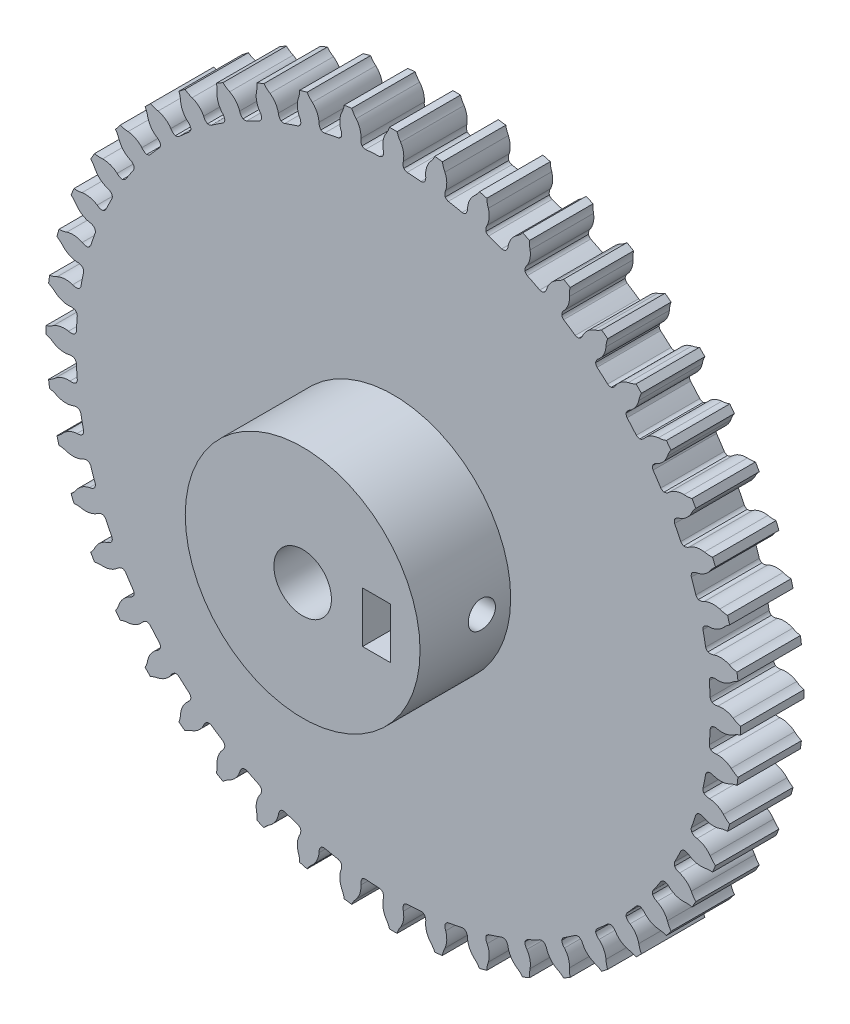
from build123d import *

# Parameters (mm, degrees)
SKETCH1_R           = 3.175
BOSS_EXTRUDE1_DEPTH = 7
SKETCH1_3_R         = 12.956207623
SKETCH1_3_R_2       = 3.175
BOSS_EXTRUDE2_DEPTH = 17
SKETCH2_W           = 3.1
SKETCH2_H           = 5.6
CUT_EXTRUDE1_DEPTH  = 8.5
CUT_EXTRUDE2_DEPTH  = 3.1
SKETCH4_R           = 1.5
CUT_EXTRUDE3_DEPTH  = 11.1


with BuildPart() as part:
    # Sketch1 → Boss-Extrude1 (new body)
    with BuildSketch(Plane.XY):
        with BuildLine():
            ThreePointArc((27.683044726, 56.438791894), (27.524119176, 56.020070925), (27.295284395, 55.635078427))
            ThreePointArc((27.295284395, 55.635078427), (26.982723732, 54.827190352), (26.985570972, 53.960951815))
            ThreePointArc((26.985570972, 53.960951815), (27.029657831, 53.626193463), (26.943690328, 53.299671803))
            ThreePointArc((26.943690328, 53.299671803), (26.780268889, 53.169967492), (26.584598572, 53.097559604))
            ThreePointArc((26.584598572, 53.097559604), (25.814147706, 53.055584927), (25.04480936, 52.996636487))
            ThreePointArc((25.04480936, 52.996636487), (24.841361904, 53.042884814), (24.662408748, 53.150148709))
            ThreePointArc((24.662408748, 53.150148709), (24.53455708, 53.46265592), (24.534572037, 53.800304858))
            ThreePointArc((24.534572037, 53.800304858), (24.424328101, 54.659504243), (24.008990883, 55.41968337))
            ThreePointArc((24.008990883, 55.41968337), (23.73186221, 55.771513271), (23.519642236, 56.165908078))
            Line((23.519642236, 56.165908078), (22.686407183, 56.056210602))
            ThreePointArc((22.686407183, 56.056210602), (22.583495317, 55.620327902), (22.406869853, 55.208760135))
            ThreePointArc((22.406869853, 55.208760135), (22.202433744, 54.366986302), (22.318323443, 53.508530195))
            ThreePointArc((22.318323443, 53.508530195), (22.405727867, 53.182390237), (22.363115456, 52.847441005))
            ThreePointArc((22.363115456, 52.847441005), (22.21802192, 52.697515553), (22.033476715, 52.600187024))
            ThreePointArc((22.033476715, 52.600187024), (21.275095959, 52.458007428), (20.520033724, 52.299144495))
            ThreePointArc((20.520033724, 52.299144495), (20.312290171, 52.31844194), (20.120867237, 52.401430103))
            ThreePointArc((20.120867237, 52.401430103), (19.953318981, 52.694575779), (19.90926178, 53.029338036))
            ThreePointArc((19.90926178, 53.029338036), (19.687812972, 53.866797131), (19.176805735, 54.566260435))
            ThreePointArc((19.176805735, 54.566260435), (18.856124919, 54.878907832), (18.594241664, 55.242228271))
            Line((18.594241664, 55.242228271), (17.782453446, 55.024710273))
            ThreePointArc((17.782453446, 55.024710273), (17.737316114, 54.579123916), (17.615922079, 54.14802292))
            ThreePointArc((17.615922079, 54.14802292), (17.523108482, 53.286766311), (17.750057736, 52.450781056))
            ThreePointArc((17.750057736, 52.450781056), (17.879284209, 52.138839837), (17.880756001, 51.801194107))
            ThreePointArc((17.880756001, 51.801194107), (17.756472959, 51.633612782), (17.586210487, 51.513028928))
            ThreePointArc((17.586210487, 51.513028928), (16.852875944, 51.273077146), (16.125009145, 51.01701791))
            ThreePointArc((16.125009145, 51.01701791), (15.916524045, 51.009034287), (15.715906631, 51.066326768))
            ThreePointArc((15.715906631, 51.066326768), (15.511528585, 51.335095107), (15.424153057, 51.661242807))
            ThreePointArc((15.424153057, 51.661242807), (15.095288427, 52.462632454), (14.497354646, 53.089411923))
            ThreePointArc((14.497354646, 53.089411923), (14.138608625, 53.357527332), (13.831542984, 53.683556891))
            Line((13.831542984, 53.683556891), (13.055091522, 53.361940165))
            ThreePointArc((13.055091522, 53.361940165), (13.068501037, 52.914274256), (13.004415517, 52.471016288))
            ThreePointArc((13.004415517, 52.471016288), (13.024812499, 51.605013243), (13.358938142, 50.805802781))
            ThreePointArc((13.358938142, 50.805802781), (13.527775565, 50.513397701), (13.573306377, 50.178832684))
            ThreePointArc((13.573306377, 50.178832684), (13.471960345, 49.996462848), (13.318893844, 49.854686894))
            ThreePointArc((13.318893844, 49.854686894), (12.623153072, 49.521068568), (11.934935711, 49.172194271))
            ThreePointArc((11.934935711, 49.172194271), (11.729276302, 49.137066183), (11.522897029, 49.167682692))
            ThreePointArc((11.522897029, 49.167682692), (11.285186157, 49.407474993), (11.155987322, 49.71942766))
            ThreePointArc((11.155987322, 49.71942766), (10.725333835, 50.471035858), (10.050704323, 51.014407123))
            ThreePointArc((10.050704323, 51.014407123), (9.66003134, 51.233403016), (9.313037292, 51.516563237))
            Line((9.313037292, 51.516563237), (8.585207887, 51.096350734))
            ThreePointArc((8.585207887, 51.096350734), (8.656934808, 50.654264962), (8.651254323, 50.206434288))
            ThreePointArc((8.651254323, 50.206434288), (8.784512885, 49.35050236), (9.220097936, 48.601741402))
            ThreePointArc((9.220097936, 48.601741402), (9.425657452, 48.333875594), (9.51446824, 48.008115791))
            ThreePointArc((9.51446824, 48.008115791), (9.437793278, 47.814077843), (9.304541757, 47.653535614))
            ThreePointArc((9.304541757, 47.653535614), (8.658299074, 47.231959044), (8.021506742, 46.796239025))
            ThreePointArc((8.021506742, 46.796239025), (7.822191913, 46.734567523), (7.613581986, 46.737984203))
            ThreePointArc((7.613581986, 46.737984203), (7.346605589, 46.944697552), (7.177794073, 47.237117588))
            ThreePointArc((7.177794073, 47.237117588), (6.652720331, 47.926084115), (5.912938186, 48.376749942))
            ThreePointArc((5.912938186, 48.376749942), (5.497022764, 48.542879237), (5.116037472, 48.778325172))
            Line((5.116037472, 48.778325172), (4.449283487, 48.266706844))
            ThreePointArc((4.449283487, 48.266706844), (4.578100546, 47.83776542), (4.630922291, 47.393024547))
            ThreePointArc((4.630922291, 47.393024547), (4.874762344, 46.561808968), (5.404353821, 45.876309021))
            ThreePointArc((5.404353821, 45.876309021), (5.643118251, 45.637565744), (5.773689437, 45.326184995))
            ThreePointArc((5.773689437, 45.326184995), (5.722997474, 45.123798977), (5.611840904, 44.947237396))
            ThreePointArc((5.611840904, 44.947237396), (5.026153701, 44.444915876), (4.451682091, 43.929805423))
            ThreePointArc((4.451682091, 43.929805423), (4.262122174, 43.842645723), (4.054850968, 43.818804114))
            ThreePointArc((4.054850968, 43.818804114), (3.763177084, 43.988901589), (3.557641301, 44.256785607))
            ThreePointArc((3.557641301, 44.256785607), (2.94713146, 44.871322053), (2.154854559, 45.221571425))
            ThreePointArc((2.154854559, 45.221571425), (1.720813127, 45.331991605), (1.312355356, 45.515694708))
            Line((1.312355356, 45.515694708), (0.718085135, 44.921424487))
            ThreePointArc((0.718085135, 44.921424487), (0.901788238, 44.512966716), (1.012208418, 44.078925284))
            ThreePointArc((1.012208418, 44.078925284), (1.36245779, 43.286648384), (1.976994236, 42.676138543))
            ThreePointArc((1.976994236, 42.676138543), (2.244878254, 42.470602759), (2.414975729, 42.178928875))
            ThreePointArc((2.414975729, 42.178928875), (2.39113412, 41.971657669), (2.30397442, 41.782097753))
            ThreePointArc((2.30397442, 41.782097753), (1.788863968, 41.207626142), (1.286542448, 40.621938939))
            ThreePointArc((1.286542448, 40.621938939), (1.109980866, 40.510782369), (0.907594849, 40.460090406))
            ThreePointArc((0.907594849, 40.460090406), (0.596214099, 40.590661592), (0.357470822, 40.829426023))
            ThreePointArc((0.357470822, 40.829426023), (-0.328029125, 41.359017499), (-1.159244703, 41.602857552))
            ThreePointArc((-1.159244703, 41.602857552), (-1.603985576, 41.655679297), (-2.032927001, 41.784496357))
            Line((-2.032927001, 41.784496357), (-2.544545329, 41.117742371))
            ThreePointArc((-2.544545329, 41.117742371), (-2.309099394, 40.736757079), (-2.142970098, 40.320841658))
            ThreePointArc((-2.142970098, 40.320841658), (-1.692304272, 39.581059513), (-1.003337745, 39.05598577))
            ThreePointArc((-1.003337745, 39.05598577), (-0.710917708, 38.887174255), (-0.504204359, 38.620197857))
            ThreePointArc((-0.504204359, 38.620197857), (-0.50078768, 38.41158793), (-0.562459182, 38.212273101))
            ThreePointArc((-0.562459182, 38.212273101), (-0.998179201, 37.57548077), (-1.41975577, 36.929238086))
            ThreePointArc((-1.41975577, 36.929238086), (-1.580297999, 36.795986565), (-1.774335948, 36.719311603))
            ThreePointArc((-1.774335948, 36.719311603), (-2.100095751, 36.808122391), (-2.367961558, 37.013681907))
            ThreePointArc((-2.367961558, 37.013681907), (-3.116722517, 37.449266958), (-3.972654445, 37.582525521))
            ThreePointArc((-3.972654445, 37.582525521), (-4.420485119, 37.576845036), (-4.862570891, 37.648571957))
            Line((-4.862570891, 37.648571957), (-5.282783394, 36.920742551))
            ThreePointArc((-5.282783394, 36.920742551), (-4.999623172, 36.573748503), (-4.78062728, 36.18307552))
            ThreePointArc((-4.78062728, 36.18307552), (-4.237256015, 35.508446008), (-3.485647816, 35.077792522))
            ThreePointArc((-3.485647816, 35.077792522), (-3.173695149, 34.948593686), (-2.933902849, 34.710882815))
            ThreePointArc((-2.933902849, 34.710882815), (-2.90328634, 34.504503541), (-2.938414428, 34.298844132))
            ThreePointArc((-2.938414428, 34.298844132), (-3.287288724, 33.610626772), (-3.620907051, 32.914886))
            ThreePointArc((-3.620907051, 32.914886), (-3.762683005, 32.761819498), (-3.945052841, 32.660473466))
            ThreePointArc((-3.945052841, 32.660473466), (-4.279617858, 32.706004279), (-4.572022937, 32.874841701))
            ThreePointArc((-4.572022937, 32.874841701), (-5.3712334, 33.208967344), (-6.237236444, 33.229364327))
            ThreePointArc((-6.237236444, 33.229364327), (-6.680494413, 33.165278806), (-7.128160322, 33.178688321))
            Line((-7.128160322, 33.178688321), (-7.449777048, 32.402236859))
            ThreePointArc((-7.449777048, 32.402236859), (-7.123747489, 32.095171218), (-6.85563208, 31.736425197))
            ThreePointArc((-6.85563208, 31.736425197), (-6.22885261, 31.138491416), (-5.427462964, 30.809626786))
            ThreePointArc((-5.427462964, 30.809626786), (-5.101315263, 30.722251258), (-4.832546925, 30.517873212))
            ThreePointArc((-4.832546925, 30.517873212), (-4.775254443, 30.317255798), (-4.783238066, 30.108770698))
            ThreePointArc((-4.783238066, 30.108770698), (-5.039297303, 29.380903899), (-5.279249085, 28.647569357))
            ThreePointArc((-5.279249085, 28.647569357), (-5.399832938, 28.477306884), (-5.567414263, 28.353023842))
            ThreePointArc((-5.567414263, 28.353023842), (-5.905059994, 28.354495634), (-6.217001213, 28.483722108))
            ThreePointArc((-6.217001213, 28.483722108), (-7.052986468, 28.710671361), (-7.914243076, 28.617857764))
            ThreePointArc((-7.914243076, 28.617857764), (-8.345344073, 28.49646373), (-8.79093043, 28.451326398))
            Line((-8.79093043, 28.451326398), (-9.008448428, 27.639538179))
            ThreePointArc((-9.008448428, 27.639538179), (-8.645127988, 27.377654925), (-8.332480591, 27.056974108))
            ThreePointArc((-8.332480591, 27.056974108), (-7.633017288, 26.545966872), (-6.795558193, 26.324518063))
            ThreePointArc((-6.795558193, 26.324518063), (-6.460795936, 26.280460862), (-6.16765026, 26.112912607))
            ThreePointArc((-6.16765026, 26.112912607), (-6.084662096, 25.921489672), (-6.065364652, 25.713746119))
            ThreePointArc((-6.065364652, 25.713746119), (-6.224227585, 24.958683884), (-6.36640718, 24.200303128))
            ThreePointArc((-6.36640718, 24.200303128), (-6.46373571, 24.015757923), (-6.613661161, 23.870664387))
            ThreePointArc((-6.613661161, 23.870664387), (-6.948610393, 23.828051977), (-7.274750352, 23.9154564))
            ThreePointArc((-7.274750352, 23.9154564), (-8.133206458, 24.031346099), (-8.974980292, 23.82690999))
            ThreePointArc((-8.974980292, 23.82690999), (-9.386548058, 23.650284527), (-9.822430759, 23.54737266))
            Line((-9.822430759, 23.54737266), (-9.932128235, 22.714137607))
            ThreePointArc((-9.932128235, 22.714137607), (-9.537733428, 22.501917633), (-9.185903527, 22.22478896))
            ThreePointArc((-9.185903527, 22.22478896), (-8.4257244, 21.809451742), (-7.566525014, 21.699207806))
            ThreePointArc((-7.566525014, 21.699207806), (-7.228876076, 21.699222763), (-6.916368866, 21.571371095))
            ThreePointArc((-6.916368866, 21.571371095), (-6.809104971, 21.392417939), (-6.762856644, 21.188970483))
            ThreePointArc((-6.762856644, 21.188970483), (-6.821805084, 20.419632137), (-6.863779761, 19.649181272))
            ThreePointArc((-6.863779761, 19.649181272), (-6.936187649, 19.453510955), (-7.06589196, 19.290089515))
            ThreePointArc((-7.06589196, 19.290089515), (-7.39241362, 19.204122012), (-7.727171972, 19.248208872))
            ThreePointArc((-7.727171972, 19.248208872), (-8.593410509, 19.251056112), (-9.401298584, 18.938495449))
            ThreePointArc((-9.401298584, 18.938495449), (-9.786291081, 18.709660667), (-10.205012051, 18.550735117))
            Line((-10.205012051, 18.550735117), (-10.205012051, 17.710310111))
            ThreePointArc((-10.205012051, 17.710310111), (-9.786291081, 17.551384561), (-9.401298584, 17.322549779))
            ThreePointArc((-9.401298584, 17.322549779), (-8.593410509, 17.009989116), (-7.727171972, 17.012836356))
            ThreePointArc((-7.727171972, 17.012836356), (-7.39241362, 17.056923216), (-7.06589196, 16.970955712))
            ThreePointArc((-7.06589196, 16.970955712), (-6.936187649, 16.807534273), (-6.863779761, 16.611863956))
            ThreePointArc((-6.863779761, 16.611863956), (-6.821805084, 15.841413091), (-6.762856644, 15.072074745))
            ThreePointArc((-6.762856644, 15.072074745), (-6.809104971, 14.868627288), (-6.916368866, 14.689674133))
            ThreePointArc((-6.916368866, 14.689674133), (-7.228876076, 14.561822464), (-7.566525014, 14.561837422))
            ThreePointArc((-7.566525014, 14.561837422), (-8.4257244, 14.451593485), (-9.185903527, 14.036256268))
            ThreePointArc((-9.185903527, 14.036256268), (-9.537733428, 13.759127595), (-9.932128235, 13.546907621))
            Line((-9.932128235, 13.546907621), (-9.822430759, 12.713672567))
            ThreePointArc((-9.822430759, 12.713672567), (-9.386548058, 12.610760701), (-8.974980292, 12.434135238))
            ThreePointArc((-8.974980292, 12.434135238), (-8.133206458, 12.229699128), (-7.274750352, 12.345588828))
            ThreePointArc((-7.274750352, 12.345588828), (-6.948610393, 12.432993251), (-6.613661161, 12.390380841))
            ThreePointArc((-6.613661161, 12.390380841), (-6.46373571, 12.245287304), (-6.36640718, 12.0607421))
            ThreePointArc((-6.36640718, 12.0607421), (-6.224227585, 11.302361343), (-6.065364652, 10.547299109))
            ThreePointArc((-6.065364652, 10.547299109), (-6.084662096, 10.339555556), (-6.16765026, 10.148132621))
            ThreePointArc((-6.16765026, 10.148132621), (-6.460795936, 9.980584365), (-6.795558193, 9.936527165))
            ThreePointArc((-6.795558193, 9.936527165), (-7.633017288, 9.715078356), (-8.332480591, 9.204071119))
            ThreePointArc((-8.332480591, 9.204071119), (-8.645127988, 8.883390303), (-9.008448428, 8.621507048))
            Line((-9.008448428, 8.621507048), (-8.79093043, 7.80971883))
            ThreePointArc((-8.79093043, 7.80971883), (-8.345344073, 7.764581498), (-7.914243076, 7.643187463))
            ThreePointArc((-7.914243076, 7.643187463), (-7.052986468, 7.550373867), (-6.217001213, 7.77732312))
            ThreePointArc((-6.217001213, 7.77732312), (-5.905059994, 7.906549594), (-5.567414263, 7.908021386))
            ThreePointArc((-5.567414263, 7.908021386), (-5.399832938, 7.783738343), (-5.279249085, 7.613475871))
            ThreePointArc((-5.279249085, 7.613475871), (-5.039297303, 6.880141328), (-4.783238066, 6.15227453))
            ThreePointArc((-4.783238066, 6.15227453), (-4.775254443, 5.943789429), (-4.832546925, 5.743172016))
            ThreePointArc((-4.832546925, 5.743172016), (-5.101315263, 5.53879397), (-5.427462964, 5.451418442))
            ThreePointArc((-5.427462964, 5.451418442), (-6.22885261, 5.122553812), (-6.85563208, 4.524620031))
            ThreePointArc((-6.85563208, 4.524620031), (-7.123747489, 4.165874009), (-7.449777048, 3.858808369))
            Line((-7.449777048, 3.858808369), (-7.128160322, 3.082356907))
            ThreePointArc((-7.128160322, 3.082356907), (-6.680494413, 3.095766422), (-6.237236444, 3.031680901))
            ThreePointArc((-6.237236444, 3.031680901), (-5.3712334, 3.052077883), (-4.572022937, 3.386203527))
            ThreePointArc((-4.572022937, 3.386203527), (-4.279617858, 3.555040949), (-3.945052841, 3.600571762))
            ThreePointArc((-3.945052841, 3.600571762), (-3.762683005, 3.49922573), (-3.620907051, 3.346159228))
            ThreePointArc((-3.620907051, 3.346159228), (-3.287288724, 2.650418456), (-2.938414428, 1.962201096))
            ThreePointArc((-2.938414428, 1.962201096), (-2.90328634, 1.756541687), (-2.933902849, 1.550162413))
            ThreePointArc((-2.933902849, 1.550162413), (-3.173695149, 1.312451542), (-3.485647816, 1.183252706))
            ThreePointArc((-3.485647816, 1.183252706), (-4.237256015, 0.75259922), (-4.78062728, 0.077969708))
            ThreePointArc((-4.78062728, 0.077969708), (-4.999623172, -0.312703275), (-5.282783394, -0.659697324))
            Line((-5.282783394, -0.659697324), (-4.862570891, -1.387526729))
            ThreePointArc((-4.862570891, -1.387526729), (-4.420485119, -1.315799808), (-3.972654445, -1.321480293))
            ThreePointArc((-3.972654445, -1.321480293), (-3.116722517, -1.18822173), (-2.367961558, -0.752636679))
            ThreePointArc((-2.367961558, -0.752636679), (-2.100095751, -0.547077163), (-1.774335947, -0.458266375))
            ThreePointArc((-1.774335947, -0.458266375), (-1.580297999, -0.534941337), (-1.41975577, -0.668192859))
            ThreePointArc((-1.41975577, -0.668192859), (-0.998179201, -1.314435542), (-0.562459182, -1.951227874))
            ThreePointArc((-0.562459182, -1.951227874), (-0.50078768, -2.150542703), (-0.504204359, -2.359152629))
            ThreePointArc((-0.504204359, -2.359152629), (-0.710917708, -2.626129027), (-1.003337745, -2.794940543))
            ThreePointArc((-1.003337745, -2.794940543), (-1.692304272, -3.320014285), (-2.142970098, -4.05979643))
            ThreePointArc((-2.142970098, -4.05979643), (-2.309099394, -4.475711851), (-2.544545329, -4.856697143))
            Line((-2.544545329, -4.856697143), (-2.032927001, -5.523451129))
            ThreePointArc((-2.032927001, -5.523451129), (-1.603985576, -5.394634069), (-1.159244703, -5.341812324))
            ThreePointArc((-1.159244703, -5.341812324), (-0.328029125, -5.097972272), (0.357470822, -4.568380795))
            ThreePointArc((0.357470822, -4.568380795), (0.596214099, -4.329616365), (0.907594849, -4.199045178))
            ThreePointArc((0.907594849, -4.199045178), (1.109980866, -4.249737141), (1.286542448, -4.360893711))
            ThreePointArc((1.286542448, -4.360893711), (1.788863968, -4.946580915), (2.30397442, -5.521052525))
            ThreePointArc((2.30397442, -5.521052525), (2.39113412, -5.710612441), (2.414975729, -5.917883647))
            ThreePointArc((2.414975729, -5.917883647), (2.244878254, -6.209557531), (1.976994236, -6.415093315))
            ThreePointArc((1.976994236, -6.415093315), (1.36245779, -7.025603156), (1.012208418, -7.817880056))
            ThreePointArc((1.012208418, -7.817880056), (0.901788238, -8.251921488), (0.718085135, -8.660379259))
            Line((0.718085135, -8.660379259), (1.312355356, -9.25464948))
            ThreePointArc((1.312355356, -9.25464948), (1.720813127, -9.070946377), (2.154854559, -8.960526197))
            ThreePointArc((2.154854559, -8.960526197), (2.94713146, -8.610276826), (3.557641301, -7.995740379))
            ThreePointArc((3.557641301, -7.995740379), (3.763177084, -7.727856361), (4.054850968, -7.557758886))
            ThreePointArc((4.054850968, -7.557758886), (4.262122174, -7.581600496), (4.451682091, -7.668760195))
            ThreePointArc((4.451682091, -7.668760195), (5.026153701, -8.183870648), (5.611840904, -8.686192168))
            ThreePointArc((5.611840904, -8.686192168), (5.722997474, -8.862753749), (5.773689437, -9.065139767))
            ThreePointArc((5.773689437, -9.065139767), (5.643118251, -9.376520516), (5.404353821, -9.615263793))
            ThreePointArc((5.404353821, -9.615263793), (4.874762344, -10.30076374), (4.630922291, -11.131979319))
            ThreePointArc((4.630922291, -11.131979319), (4.578100546, -11.576720192), (4.449283487, -12.005661617))
            Line((4.449283487, -12.005661617), (5.116037472, -12.517279944))
            ThreePointArc((5.116037472, -12.517279944), (5.497022764, -12.281834009), (5.912938186, -12.115704714))
            ThreePointArc((5.912938186, -12.115704714), (6.652720331, -11.665038887), (7.177794073, -10.97607236))
            ThreePointArc((7.177794073, -10.97607236), (7.346605589, -10.683652324), (7.613581986, -10.476938975))
            ThreePointArc((7.613581986, -10.476938975), (7.822191913, -10.473522295), (8.021506742, -10.535193797))
            ThreePointArc((8.021506742, -10.535193797), (8.658299074, -10.970913817), (9.304541757, -11.392490386))
            ThreePointArc((9.304541757, -11.392490386), (9.437793278, -11.553032615), (9.51446824, -11.747070563))
            ThreePointArc((9.51446824, -11.747070563), (9.425657452, -12.072830366), (9.220097936, -12.340696174))
            ThreePointArc((9.220097936, -12.340696174), (8.784512885, -13.089457133), (8.651254322, -13.94538906))
            ThreePointArc((8.651254322, -13.94538906), (8.656934808, -14.393219735), (8.585207887, -14.835305506))
            Line((8.585207887, -14.835305506), (9.313037292, -15.255518009))
            ThreePointArc((9.313037292, -15.255518009), (9.66003134, -14.972357788), (10.050704323, -14.753361895))
            ThreePointArc((10.050704323, -14.753361895), (10.725333835, -14.20999063), (11.155987322, -13.458382432))
            ThreePointArc((11.155987322, -13.458382432), (11.285186157, -13.146429765), (11.522897029, -12.906637465))
            ThreePointArc((11.522897029, -12.906637465), (11.729276302, -12.876020955), (11.934935711, -12.911149044))
            ThreePointArc((11.934935711, -12.911149044), (12.623153072, -13.26002334), (13.318893844, -13.593641666))
            ThreePointArc((13.318893844, -13.593641666), (13.471960345, -13.73541762), (13.573306377, -13.917787456))
            ThreePointArc((13.573306377, -13.917787456), (13.527775565, -14.252352473), (13.358938142, -14.544757553))
            ThreePointArc((13.358938142, -14.544757553), (13.024812499, -15.343968016), (13.004415517, -16.20997106))
            ThreePointArc((13.004415517, -16.20997106), (13.068501037, -16.653229029), (13.055091522, -17.100894937))
            Line((13.055091522, -17.100894937), (13.831542984, -17.422511663))
            ThreePointArc((13.831542984, -17.422511663), (14.138608625, -17.096482105), (14.497354646, -16.828366695))
            ThreePointArc((14.497354646, -16.828366695), (15.095288427, -16.201587226), (15.424153057, -15.40019758))
            ThreePointArc((15.424153057, -15.40019758), (15.511528585, -15.074049879), (15.715906631, -14.80528154))
            ThreePointArc((15.715906631, -14.80528154), (15.916524045, -14.747989059), (16.125009145, -14.755972682))
            ThreePointArc((16.125009145, -14.755972682), (16.852875944, -15.012031918), (17.586210487, -15.2519837))
            ThreePointArc((17.586210487, -15.2519837), (17.756472959, -15.372567554), (17.880756001, -15.540148879))
            ThreePointArc((17.880756001, -15.540148879), (17.879284209, -15.877794609), (17.750057736, -16.189735829))
            ThreePointArc((17.750057736, -16.189735829), (17.523108482, -17.025721083), (17.615922079, -17.886977692))
            ThreePointArc((17.615922079, -17.886977692), (17.737316114, -18.318078688), (17.782453446, -18.763665046))
            Line((17.782453446, -18.763665046), (18.594241664, -18.981183043))
            ThreePointArc((18.594241664, -18.981183043), (18.856124919, -18.617862604), (19.176805735, -18.305215207))
            ThreePointArc((19.176805735, -18.305215207), (19.687812972, -17.605751903), (19.90926178, -16.768292809))
            ThreePointArc((19.90926178, -16.768292809), (19.953318981, -16.433530552), (20.120867237, -16.140384875))
            ThreePointArc((20.120867237, -16.140384875), (20.312290171, -16.057396712), (20.520033724, -16.038099267))
            ThreePointArc((20.520033724, -16.038099267), (21.275095959, -16.1969622), (22.033476715, -16.339141796))
            ThreePointArc((22.033476715, -16.339141796), (22.21802192, -16.436470326), (22.363115456, -16.586395777))
            ThreePointArc((22.363115456, -16.586395777), (22.405727866, -16.921345009), (22.318323443, -17.247484967))
            ThreePointArc((22.318323443, -17.247484967), (22.202433744, -18.105941074), (22.406869853, -18.947714907))
            ThreePointArc((22.406869853, -18.947714907), (22.583495317, -19.359282674), (22.686407183, -19.795165374))
            Line((22.686407183, -19.795165374), (23.519642236, -19.90486285))
            ThreePointArc((23.519642236, -19.90486285), (23.73186221, -19.510468044), (24.008990883, -19.158638142))
            ThreePointArc((24.008990883, -19.158638142), (24.424328101, -18.398459015), (24.534572037, -17.53925963))
            ThreePointArc((24.534572037, -17.53925963), (24.53455708, -17.201610692), (24.662408748, -16.889103481))
            ThreePointArc((24.662408748, -16.889103481), (24.841361904, -16.781839586), (25.04480936, -16.735591259))
            ThreePointArc((25.04480936, -16.735591259), (25.814147706, -16.794539699), (26.584598572, -16.836514376))
            ThreePointArc((26.584598572, -16.836514376), (26.780268889, -16.908922264), (26.943690328, -17.038626576))
            ThreePointArc((26.943690328, -17.038626576), (27.029657831, -17.365148235), (26.985570971, -17.699906587))
            ThreePointArc((26.985570971, -17.699906587), (26.982723731, -18.566145124), (27.295284395, -19.374033199))
            ThreePointArc((27.295284395, -19.374033199), (27.524119176, -19.759025697), (27.683044726, -20.177746666))
            Line((27.683044726, -20.177746666), (28.523469732, -20.177746666))
            ThreePointArc((28.523469732, -20.177746666), (28.682395282, -19.759025697), (28.911230064, -19.374033199))
            ThreePointArc((28.911230064, -19.374033199), (29.223790727, -18.566145124), (29.220943487, -17.699906587))
            ThreePointArc((29.220943487, -17.699906587), (29.176856628, -17.365148235), (29.262824131, -17.038626576))
            ThreePointArc((29.262824131, -17.038626576), (29.42624557, -16.908922264), (29.621915887, -16.836514376))
            ThreePointArc((29.621915887, -16.836514376), (30.392366752, -16.794539699), (31.161705099, -16.735591259))
            ThreePointArc((31.161705099, -16.735591259), (31.365152555, -16.781839586), (31.544105711, -16.889103481))
            ThreePointArc((31.544105711, -16.889103481), (31.671957379, -17.201610692), (31.671942422, -17.53925963))
            ThreePointArc((31.671942422, -17.53925963), (31.782186358, -18.398459015), (32.197523575, -19.158638142))
            ThreePointArc((32.197523575, -19.158638142), (32.474652249, -19.510468044), (32.686872222, -19.90486285))
            Line((32.686872222, -19.90486285), (33.520107276, -19.795165374))
            ThreePointArc((33.520107276, -19.795165374), (33.623019142, -19.359282674), (33.799644606, -18.947714907))
            ThreePointArc((33.799644606, -18.947714907), (34.004080715, -18.105941074), (33.888191016, -17.247484967))
            ThreePointArc((33.888191016, -17.247484967), (33.800786592, -16.921345009), (33.843399003, -16.586395777))
            ThreePointArc((33.843399003, -16.586395777), (33.988492539, -16.436470326), (34.173037743, -16.339141796))
            ThreePointArc((34.173037743, -16.339141796), (34.9314185, -16.1969622), (35.686480734, -16.038099267))
            ThreePointArc((35.686480734, -16.038099267), (35.894224287, -16.057396712), (36.085647222, -16.140384875))
            ThreePointArc((36.085647222, -16.140384875), (36.253195478, -16.433530552), (36.297252679, -16.768292809))
            ThreePointArc((36.297252679, -16.768292809), (36.518701487, -17.605751903), (37.029708724, -18.305215207))
            ThreePointArc((37.029708724, -18.305215207), (37.35038954, -18.617862604), (37.612272795, -18.981183043))
            Line((37.612272795, -18.981183043), (38.424061013, -18.763665046))
            ThreePointArc((38.424061013, -18.763665046), (38.469198345, -18.318078688), (38.59059238, -17.886977692))
            ThreePointArc((38.59059238, -17.886977692), (38.683405977, -17.025721083), (38.456456723, -16.189735829))
            ThreePointArc((38.456456723, -16.189735829), (38.32723025, -15.877794609), (38.325758457, -15.540148879))
            ThreePointArc((38.325758457, -15.540148879), (38.4500415, -15.372567554), (38.620303972, -15.2519837))
            ThreePointArc((38.620303972, -15.2519837), (39.353638515, -15.012031918), (40.081505314, -14.755972682))
            ThreePointArc((40.081505314, -14.755972682), (40.289990414, -14.747989059), (40.490607828, -14.80528154))
            ThreePointArc((40.490607828, -14.80528154), (40.694985874, -15.074049879), (40.782361402, -15.40019758))
            ThreePointArc((40.782361402, -15.40019758), (41.111226032, -16.201587226), (41.709159812, -16.828366695))
            ThreePointArc((41.709159812, -16.828366695), (42.067905834, -17.096482105), (42.374971475, -17.422511663))
            Line((42.374971475, -17.422511663), (43.151422936, -17.100894937))
            ThreePointArc((43.151422936, -17.100894937), (43.138013421, -16.653229029), (43.202098942, -16.20997106))
            ThreePointArc((43.202098942, -16.20997106), (43.18170196, -15.343968016), (42.847576317, -14.544757553))
            ThreePointArc((42.847576317, -14.544757553), (42.678738894, -14.252352473), (42.633208082, -13.917787456))
            ThreePointArc((42.633208082, -13.917787456), (42.734554113, -13.73541762), (42.887620615, -13.593641666))
            ThreePointArc((42.887620615, -13.593641666), (43.583361387, -13.26002334), (44.271578747, -12.911149044))
            ThreePointArc((44.271578747, -12.911149044), (44.477238156, -12.876020955), (44.68361743, -12.906637465))
            ThreePointArc((44.68361743, -12.906637465), (44.921328301, -13.146429765), (45.050527137, -13.458382432))
            ThreePointArc((45.050527137, -13.458382432), (45.481180623, -14.209990631), (46.155810135, -14.753361895))
            ThreePointArc((46.155810135, -14.753361895), (46.546483118, -14.972357788), (46.893477167, -15.255518009))
            Line((46.893477167, -15.255518009), (47.621306572, -14.835305506))
            ThreePointArc((47.621306572, -14.835305506), (47.549579651, -14.393219735), (47.555260136, -13.94538906))
            ThreePointArc((47.555260136, -13.94538906), (47.422001573, -13.089457133), (46.986416523, -12.340696174))
            ThreePointArc((46.986416523, -12.340696174), (46.780857006, -12.072830366), (46.692046218, -11.747070563))
            ThreePointArc((46.692046218, -11.747070563), (46.76872118, -11.553032615), (46.901972702, -11.392490386))
            ThreePointArc((46.901972702, -11.392490386), (47.548215385, -10.970913817), (48.185007717, -10.535193797))
            ThreePointArc((48.185007717, -10.535193797), (48.384322546, -10.473522295), (48.592932472, -10.476938975))
            ThreePointArc((48.592932472, -10.476938975), (48.85990887, -10.683652324), (49.028720386, -10.976072361))
            ThreePointArc((49.028720386, -10.976072361), (49.553794128, -11.665038887), (50.293576273, -12.115704714))
            ThreePointArc((50.293576273, -12.115704714), (50.709491695, -12.281834009), (51.090476986, -12.517279944))
            Line((51.090476986, -12.517279944), (51.757230972, -12.005661617))
            ThreePointArc((51.757230972, -12.005661617), (51.628413912, -11.576720192), (51.575592168, -11.131979319))
            ThreePointArc((51.575592168, -11.131979319), (51.331752115, -10.30076374), (50.802160638, -9.615263793))
            ThreePointArc((50.802160638, -9.615263793), (50.563396208, -9.376520516), (50.432825022, -9.065139767))
            ThreePointArc((50.432825022, -9.065139767), (50.483516984, -8.862753749), (50.594673555, -8.686192168))
            ThreePointArc((50.594673555, -8.686192168), (51.180360758, -8.183870648), (51.754832368, -7.668760195))
            ThreePointArc((51.754832368, -7.668760195), (51.944392285, -7.581600496), (52.151663491, -7.557758886))
            ThreePointArc((52.151663491, -7.557758886), (52.443337375, -7.727856361), (52.648873158, -7.995740379))
            ThreePointArc((52.648873158, -7.995740379), (53.259382999, -8.610276826), (54.0516599, -8.960526197))
            ThreePointArc((54.0516599, -8.960526197), (54.485701331, -9.070946377), (54.894159103, -9.25464948))
            Line((54.894159103, -9.25464948), (55.488429323, -8.660379259))
            ThreePointArc((55.488429323, -8.660379259), (55.304726221, -8.251921488), (55.194306041, -7.817880056))
            ThreePointArc((55.194306041, -7.817880056), (54.844056669, -7.025603156), (54.229520223, -6.415093315))
            ThreePointArc((54.229520223, -6.415093315), (53.961636204, -6.209557531), (53.791538729, -5.917883647))
            ThreePointArc((53.791538729, -5.917883647), (53.815380339, -5.710612441), (53.902540038, -5.521052525))
            ThreePointArc((53.902540038, -5.521052525), (54.417650491, -4.946580915), (54.919972011, -4.360893711))
            ThreePointArc((54.919972011, -4.360893711), (55.096533593, -4.249737141), (55.29891961, -4.199045178))
            ThreePointArc((55.29891961, -4.199045178), (55.610300359, -4.329616365), (55.849043637, -4.568380795))
            ThreePointArc((55.849043637, -4.568380795), (56.534543584, -5.097972272), (57.365759162, -5.341812324))
            ThreePointArc((57.365759162, -5.341812324), (57.810500035, -5.394634069), (58.23944146, -5.523451129))
            Line((58.23944146, -5.523451129), (58.751059787, -4.856697143))
            ThreePointArc((58.751059787, -4.856697143), (58.515613853, -4.475711851), (58.349484557, -4.05979643))
            ThreePointArc((58.349484557, -4.05979643), (57.89881873, -3.320014285), (57.209852204, -2.794940543))
            ThreePointArc((57.209852204, -2.794940543), (56.917432167, -2.626129027), (56.710718818, -2.359152629))
            ThreePointArc((56.710718818, -2.359152629), (56.707302138, -2.150542703), (56.76897364, -1.951227874))
            ThreePointArc((56.76897364, -1.951227874), (57.20469366, -1.314435542), (57.626270229, -0.668192859))
            ThreePointArc((57.626270229, -0.668192859), (57.786812458, -0.534941337), (57.980850406, -0.458266375))
            ThreePointArc((57.980850406, -0.458266375), (58.30661021, -0.547077163), (58.574476017, -0.75263668))
            ThreePointArc((58.574476017, -0.75263668), (59.323236976, -1.18822173), (60.179168904, -1.321480293))
            ThreePointArc((60.179168904, -1.321480293), (60.626999578, -1.315799808), (61.06908535, -1.387526729))
            Line((61.06908535, -1.387526729), (61.489297853, -0.659697324))
            ThreePointArc((61.489297853, -0.659697324), (61.206137631, -0.312703275), (60.987141738, 0.077969708))
            ThreePointArc((60.987141738, 0.077969708), (60.443770474, 0.75259922), (59.692162275, 1.183252706))
            ThreePointArc((59.692162275, 1.183252706), (59.380209608, 1.312451542), (59.140417308, 1.550162413))
            ThreePointArc((59.140417308, 1.550162413), (59.109800799, 1.756541687), (59.144928887, 1.962201096))
            ThreePointArc((59.144928887, 1.962201096), (59.493803183, 2.650418456), (59.82742151, 3.346159228))
            ThreePointArc((59.82742151, 3.346159228), (59.969197464, 3.49922573), (60.1515673, 3.600571762))
            ThreePointArc((60.1515673, 3.600571762), (60.486132317, 3.555040949), (60.778537396, 3.386203527))
            ThreePointArc((60.778537396, 3.386203527), (61.577747859, 3.052077883), (62.443750903, 3.031680901))
            ThreePointArc((62.443750903, 3.031680901), (62.887008872, 3.095766422), (63.33467478, 3.082356907))
            Line((63.33467478, 3.082356907), (63.656291506, 3.858808368))
            ThreePointArc((63.656291506, 3.858808368), (63.330261948, 4.165874009), (63.062146538, 4.524620031))
            ThreePointArc((63.062146538, 4.524620031), (62.435367069, 5.122553812), (61.633977423, 5.451418441))
            ThreePointArc((61.633977423, 5.451418441), (61.307829722, 5.53879397), (61.039061383, 5.743172016))
            ThreePointArc((61.039061383, 5.743172016), (60.981768902, 5.943789429), (60.989752525, 6.15227453))
            ThreePointArc((60.989752525, 6.15227453), (61.245811762, 6.880141328), (61.485763544, 7.613475871))
            ThreePointArc((61.485763544, 7.613475871), (61.606347397, 7.783738343), (61.773928722, 7.908021386))
            ThreePointArc((61.773928722, 7.908021386), (62.111574453, 7.906549594), (62.423515672, 7.77732312))
            ThreePointArc((62.423515672, 7.77732312), (63.259500926, 7.550373867), (64.120757535, 7.643187463))
            ThreePointArc((64.120757535, 7.643187463), (64.551858531, 7.764581498), (64.997444889, 7.80971883))
            Line((64.997444889, 7.80971883), (65.214962886, 8.621507048))
            ThreePointArc((65.214962886, 8.621507048), (64.851642447, 8.883390303), (64.53899505, 9.204071119))
            ThreePointArc((64.53899505, 9.204071119), (63.839531746, 9.715078356), (63.002072652, 9.936527165))
            ThreePointArc((63.002072652, 9.936527165), (62.667310395, 9.980584365), (62.374164718, 10.148132621))
            ThreePointArc((62.374164718, 10.148132621), (62.291176555, 10.339555556), (62.271879111, 10.547299109))
            ThreePointArc((62.271879111, 10.547299109), (62.430742043, 11.302361343), (62.572921639, 12.0607421))
            ThreePointArc((62.572921639, 12.0607421), (62.670250169, 12.245287304), (62.82017562, 12.390380841))
            ThreePointArc((62.82017562, 12.390380841), (63.155124852, 12.432993251), (63.48126481, 12.345588828))
            ThreePointArc((63.48126481, 12.345588828), (64.339720917, 12.229699128), (65.181494751, 12.434135238))
            ThreePointArc((65.181494751, 12.434135238), (65.593062517, 12.610760701), (66.028945218, 12.713672567))
            Line((66.028945218, 12.713672567), (66.138642693, 13.546907621))
            ThreePointArc((66.138642693, 13.546907621), (65.744247887, 13.759127595), (65.392417986, 14.036256268))
            ThreePointArc((65.392417986, 14.036256268), (64.632238859, 14.451593485), (63.773039473, 14.561837422))
            ThreePointArc((63.773039473, 14.561837422), (63.435390535, 14.561822464), (63.122883325, 14.689674133))
            ThreePointArc((63.122883325, 14.689674133), (63.01561943, 14.868627288), (62.969371103, 15.072074745))
            ThreePointArc((62.969371103, 15.072074745), (63.028319543, 15.841413091), (63.07029422, 16.611863956))
            ThreePointArc((63.07029422, 16.611863956), (63.142702108, 16.807534273), (63.272406419, 16.970955712))
            ThreePointArc((63.272406419, 16.970955712), (63.598928078, 17.056923215), (63.933686431, 17.012836356))
            ThreePointArc((63.933686431, 17.012836356), (64.799924967, 17.009989116), (65.607813042, 17.322549779))
            ThreePointArc((65.607813042, 17.322549779), (65.99280554, 17.551384561), (66.41152651, 17.710310111))
            Line((66.41152651, 17.710310111), (66.41152651, 18.550735117))
            ThreePointArc((66.41152651, 18.550735117), (65.99280554, 18.709660667), (65.607813042, 18.938495449))
            ThreePointArc((65.607813042, 18.938495449), (64.799924967, 19.251056112), (63.933686431, 19.248208872))
            ThreePointArc((63.933686431, 19.248208872), (63.598928078, 19.204122012), (63.272406419, 19.290089515))
            ThreePointArc((63.272406419, 19.290089515), (63.142702108, 19.453510955), (63.07029422, 19.649181272))
            ThreePointArc((63.07029422, 19.649181272), (63.028319543, 20.419632137), (62.969371103, 21.188970483))
            ThreePointArc((62.969371103, 21.188970483), (63.01561943, 21.392417939), (63.122883325, 21.571371095))
            ThreePointArc((63.122883325, 21.571371095), (63.435390535, 21.699222763), (63.773039473, 21.699207806))
            ThreePointArc((63.773039473, 21.699207806), (64.632238859, 21.809451742), (65.392417986, 22.22478896))
            ThreePointArc((65.392417986, 22.22478896), (65.744247887, 22.501917633), (66.138642693, 22.714137607))
            Line((66.138642693, 22.714137607), (66.028945218, 23.54737266))
            ThreePointArc((66.028945218, 23.54737266), (65.593062517, 23.650284527), (65.181494751, 23.82690999))
            ThreePointArc((65.181494751, 23.82690999), (64.339720917, 24.031346099), (63.48126481, 23.9154564))
            ThreePointArc((63.48126481, 23.9154564), (63.155124852, 23.828051977), (62.82017562, 23.870664387))
            ThreePointArc((62.82017562, 23.870664387), (62.670250169, 24.015757923), (62.572921639, 24.200303128))
            ThreePointArc((62.572921639, 24.200303128), (62.430742043, 24.958683884), (62.271879111, 25.713746119))
            ThreePointArc((62.271879111, 25.713746119), (62.291176555, 25.921489672), (62.374164718, 26.112912607))
            ThreePointArc((62.374164718, 26.112912607), (62.667310395, 26.280460862), (63.002072652, 26.324518063))
            ThreePointArc((63.002072652, 26.324518063), (63.839531746, 26.545966871), (64.53899505, 27.056974108))
            ThreePointArc((64.53899505, 27.056974108), (64.851642447, 27.377654925), (65.214962886, 27.639538179))
            Line((65.214962886, 27.639538179), (64.997444889, 28.451326398))
            ThreePointArc((64.997444889, 28.451326398), (64.551858531, 28.49646373), (64.120757535, 28.617857764))
            ThreePointArc((64.120757535, 28.617857764), (63.259500926, 28.710671361), (62.423515672, 28.483722108))
            ThreePointArc((62.423515672, 28.483722108), (62.111574453, 28.354495634), (61.773928722, 28.353023842))
            ThreePointArc((61.773928722, 28.353023842), (61.606347397, 28.477306884), (61.485763544, 28.647569357))
            ThreePointArc((61.485763544, 28.647569357), (61.245811762, 29.380903899), (60.989752525, 30.108770698))
            ThreePointArc((60.989752525, 30.108770698), (60.981768902, 30.317255798), (61.039061383, 30.517873212))
            ThreePointArc((61.039061383, 30.517873212), (61.307829722, 30.722251258), (61.633977423, 30.809626786))
            ThreePointArc((61.633977423, 30.809626786), (62.435367069, 31.138491416), (63.062146539, 31.736425197))
            ThreePointArc((63.062146539, 31.736425197), (63.330261948, 32.095171218), (63.656291506, 32.402236859))
            Line((63.656291506, 32.402236859), (63.33467478, 33.178688321))
            ThreePointArc((63.33467478, 33.178688321), (62.887008872, 33.165278806), (62.443750903, 33.229364326))
            ThreePointArc((62.443750903, 33.229364326), (61.577747859, 33.208967344), (60.778537396, 32.874841701))
            ThreePointArc((60.778537396, 32.874841701), (60.486132317, 32.706004279), (60.1515673, 32.660473466))
            ThreePointArc((60.1515673, 32.660473466), (59.969197464, 32.761819498), (59.82742151, 32.914886))
            ThreePointArc((59.82742151, 32.914886), (59.493803183, 33.610626772), (59.144928887, 34.298844132))
            ThreePointArc((59.144928887, 34.298844132), (59.109800799, 34.504503541), (59.140417308, 34.710882815))
            ThreePointArc((59.140417308, 34.710882815), (59.380209608, 34.948593686), (59.692162275, 35.077792522))
            ThreePointArc((59.692162275, 35.077792522), (60.443770474, 35.508446008), (60.987141738, 36.18307552))
            ThreePointArc((60.987141738, 36.18307552), (61.206137631, 36.573748503), (61.489297853, 36.920742551))
            Line((61.489297853, 36.920742551), (61.06908535, 37.648571957))
            ThreePointArc((61.06908535, 37.648571957), (60.626999578, 37.576845036), (60.179168904, 37.582525521))
            ThreePointArc((60.179168904, 37.582525521), (59.323236976, 37.449266958), (58.574476017, 37.013681907))
            ThreePointArc((58.574476017, 37.013681907), (58.30661021, 36.808122391), (57.980850406, 36.719311603))
            ThreePointArc((57.980850406, 36.719311603), (57.786812458, 36.795986565), (57.626270229, 36.929238086))
            ThreePointArc((57.626270229, 36.929238086), (57.20469366, 37.57548077), (56.76897364, 38.212273101))
            ThreePointArc((56.76897364, 38.212273101), (56.707302138, 38.41158793), (56.710718818, 38.620197857))
            ThreePointArc((56.710718818, 38.620197857), (56.917432167, 38.887174255), (57.209852204, 39.05598577))
            ThreePointArc((57.209852204, 39.05598577), (57.89881873, 39.581059513), (58.349484557, 40.320841658))
            ThreePointArc((58.349484557, 40.320841658), (58.515613853, 40.736757079), (58.751059787, 41.117742371))
            Line((58.751059787, 41.117742371), (58.23944146, 41.784496357))
            ThreePointArc((58.23944146, 41.784496357), (57.810500035, 41.655679297), (57.365759162, 41.602857552))
            ThreePointArc((57.365759162, 41.602857552), (56.534543584, 41.359017499), (55.849043637, 40.829426022))
            ThreePointArc((55.849043637, 40.829426022), (55.610300359, 40.590661592), (55.29891961, 40.460090406))
            ThreePointArc((55.29891961, 40.460090406), (55.096533593, 40.510782369), (54.919972011, 40.621938939))
            ThreePointArc((54.919972011, 40.621938939), (54.417650491, 41.207626142), (53.902540038, 41.782097753))
            ThreePointArc((53.902540038, 41.782097753), (53.815380339, 41.971657669), (53.791538729, 42.178928875))
            ThreePointArc((53.791538729, 42.178928875), (53.961636204, 42.470602759), (54.229520223, 42.676138543))
            ThreePointArc((54.229520223, 42.676138543), (54.844056669, 43.286648384), (55.194306041, 44.078925284))
            ThreePointArc((55.194306041, 44.078925284), (55.304726221, 44.512966716), (55.488429323, 44.921424487))
            Line((55.488429323, 44.921424487), (54.894159103, 45.515694708))
            ThreePointArc((54.894159103, 45.515694708), (54.485701331, 45.331991605), (54.0516599, 45.221571425))
            ThreePointArc((54.0516599, 45.221571425), (53.259382999, 44.871322053), (52.648873158, 44.256785607))
            ThreePointArc((52.648873158, 44.256785607), (52.443337375, 43.988901589), (52.151663491, 43.818804114))
            ThreePointArc((52.151663491, 43.818804114), (51.944392285, 43.842645723), (51.754832368, 43.929805423))
            ThreePointArc((51.754832368, 43.929805423), (51.180360758, 44.444915876), (50.594673555, 44.947237396))
            ThreePointArc((50.594673555, 44.947237396), (50.483516984, 45.123798977), (50.432825022, 45.326184995))
            ThreePointArc((50.432825022, 45.326184995), (50.563396208, 45.637565744), (50.802160638, 45.876309021))
            ThreePointArc((50.802160638, 45.876309021), (51.331752115, 46.561808968), (51.575592168, 47.393024547))
            ThreePointArc((51.575592168, 47.393024547), (51.628413913, 47.83776542), (51.757230972, 48.266706844))
            Line((51.757230972, 48.266706844), (51.090476986, 48.778325172))
            ThreePointArc((51.090476986, 48.778325172), (50.709491695, 48.542879237), (50.293576273, 48.376749942))
            ThreePointArc((50.293576273, 48.376749942), (49.553794128, 47.926084115), (49.028720386, 47.237117588))
            ThreePointArc((49.028720386, 47.237117588), (48.85990887, 46.944697552), (48.592932472, 46.737984203))
            ThreePointArc((48.592932472, 46.737984203), (48.384322546, 46.734567523), (48.185007717, 46.796239025))
            ThreePointArc((48.185007717, 46.796239025), (47.548215385, 47.231959044), (46.901972702, 47.653535614))
            ThreePointArc((46.901972702, 47.653535614), (46.76872118, 47.814077843), (46.692046218, 48.008115791))
            ThreePointArc((46.692046218, 48.008115791), (46.780857006, 48.333875594), (46.986416523, 48.601741402))
            ThreePointArc((46.986416523, 48.601741402), (47.422001573, 49.35050236), (47.555260136, 50.206434288))
            ThreePointArc((47.555260136, 50.206434288), (47.549579651, 50.654264962), (47.621306572, 51.096350734))
            Line((47.621306572, 51.096350734), (46.893477167, 51.516563237))
            ThreePointArc((46.893477167, 51.516563237), (46.546483119, 51.233403016), (46.155810135, 51.014407123))
            ThreePointArc((46.155810135, 51.014407123), (45.481180624, 50.471035858), (45.050527137, 49.71942766))
            ThreePointArc((45.050527137, 49.71942766), (44.921328301, 49.407474993), (44.68361743, 49.167682692))
            ThreePointArc((44.68361743, 49.167682692), (44.477238156, 49.137066183), (44.271578747, 49.172194271))
            ThreePointArc((44.271578747, 49.172194271), (43.583361387, 49.521068568), (42.887620615, 49.854686894))
            ThreePointArc((42.887620615, 49.854686894), (42.734554113, 49.996462848), (42.633208082, 50.178832684))
            ThreePointArc((42.633208082, 50.178832684), (42.678738894, 50.513397701), (42.847576317, 50.80580278))
            ThreePointArc((42.847576317, 50.80580278), (43.18170196, 51.605013243), (43.202098942, 52.471016288))
            ThreePointArc((43.202098942, 52.471016288), (43.138013422, 52.914274256), (43.151422936, 53.361940165))
            Line((43.151422936, 53.361940165), (42.374971475, 53.683556891))
            ThreePointArc((42.374971475, 53.683556891), (42.067905834, 53.357527332), (41.709159812, 53.089411923))
            ThreePointArc((41.709159812, 53.089411923), (41.111226032, 52.462632454), (40.782361402, 51.661242807))
            ThreePointArc((40.782361402, 51.661242807), (40.694985874, 51.335095107), (40.490607828, 51.066326768))
            ThreePointArc((40.490607828, 51.066326768), (40.289990414, 51.009034287), (40.081505314, 51.01701791))
            ThreePointArc((40.081505314, 51.01701791), (39.353638515, 51.273077146), (38.620303972, 51.513028928))
            ThreePointArc((38.620303972, 51.513028928), (38.4500415, 51.633612782), (38.325758457, 51.801194107))
            ThreePointArc((38.325758457, 51.801194107), (38.32723025, 52.138839837), (38.456456723, 52.450781056))
            ThreePointArc((38.456456723, 52.450781056), (38.683405977, 53.286766311), (38.59059238, 54.14802292))
            ThreePointArc((38.59059238, 54.14802292), (38.469198345, 54.579123916), (38.424061013, 55.024710273))
            Line((38.424061013, 55.024710273), (37.612272795, 55.242228271))
            ThreePointArc((37.612272795, 55.242228271), (37.35038954, 54.878907832), (37.029708724, 54.566260435))
            ThreePointArc((37.029708724, 54.566260435), (36.518701487, 53.866797131), (36.297252679, 53.029338036))
            ThreePointArc((36.297252679, 53.029338036), (36.253195478, 52.694575779), (36.085647222, 52.401430103))
            ThreePointArc((36.085647222, 52.401430103), (35.894224287, 52.31844194), (35.686480734, 52.299144495))
            ThreePointArc((35.686480734, 52.299144495), (34.9314185, 52.458007428), (34.173037743, 52.600187024))
            ThreePointArc((34.173037743, 52.600187024), (33.988492539, 52.697515553), (33.843399003, 52.847441005))
            ThreePointArc((33.843399003, 52.847441005), (33.800786592, 53.182390237), (33.888191016, 53.508530195))
            ThreePointArc((33.888191016, 53.508530195), (34.004080715, 54.366986302), (33.799644606, 55.208760135))
            ThreePointArc((33.799644606, 55.208760135), (33.623019142, 55.620327902), (33.520107276, 56.056210602))
            Line((33.520107276, 56.056210602), (32.686872222, 56.165908078))
            ThreePointArc((32.686872222, 56.165908078), (32.474652249, 55.771513271), (32.197523575, 55.41968337))
            ThreePointArc((32.197523575, 55.41968337), (31.782186358, 54.659504243), (31.671942422, 53.800304858))
            ThreePointArc((31.671942422, 53.800304858), (31.671957379, 53.462655919), (31.544105711, 53.150148709))
            ThreePointArc((31.544105711, 53.150148709), (31.365152555, 53.042884814), (31.161705099, 52.996636487))
            ThreePointArc((31.161705099, 52.996636487), (30.392366752, 53.055584927), (29.621915887, 53.097559604))
            ThreePointArc((29.621915887, 53.097559604), (29.42624557, 53.169967492), (29.262824131, 53.299671803))
            ThreePointArc((29.262824131, 53.299671803), (29.176856628, 53.626193463), (29.220943487, 53.960951815))
            ThreePointArc((29.220943487, 53.960951815), (29.223790727, 54.827190352), (28.911230064, 55.635078427))
            ThreePointArc((28.911230064, 55.635078427), (28.682395283, 56.020070925), (28.523469732, 56.438791894))
            Line((28.523469732, 56.438791894), (27.683044726, 56.438791894))
        make_face()
        with Locations((28.103257229, 18.130522614)):
            Circle(SKETCH1_R, mode=Mode.SUBTRACT)
    extrude(amount=BOSS_EXTRUDE1_DEPTH)

    # Sketch1<3> → Boss-Extrude2 (add)
    with BuildSketch(Plane.XY):
        with Locations((28.103257229, 18.130522614)):
            Circle(SKETCH1_3_R)
        with Locations((28.103257229, 18.130522614)):
            Circle(SKETCH1_3_R_2, mode=Mode.SUBTRACT)
    extrude(amount=BOSS_EXTRUDE2_DEPTH)

    # Sketch2 → Cut-Extrude1 (cut)
    with BuildSketch(Plane.XY.offset(17)):
        with Locations((36.262798406, 18.130522614)):
            Rectangle(SKETCH2_W, SKETCH2_H)
    extrude(amount=-CUT_EXTRUDE1_DEPTH, mode=Mode.SUBTRACT)

    # Sketch3 → Cut-Extrude2 (cut)
    with BuildSketch(Plane(origin=(34.712798406, 0, 0), x_dir=(0, 0, -1), z_dir=(1, 0, 0))):
        Polygon((-8.5, 20.820251305), (-8.5, 18.130522614), (-8.5, 15.440793922), (-6.947084416, 18.130522614), align=None)
    extrude(amount=CUT_EXTRUDE2_DEPTH, mode=Mode.SUBTRACT)

    # Sketch4 → Cut-Extrude3 (cut)
    with BuildSketch(Plane(origin=(34.712798406, 0, 0), x_dir=(0, 0, -1), z_dir=(1, 0, 0))):
        with Locations((-10.180245923, 18.130522614)):
            Circle(SKETCH4_R)
    extrude(amount=CUT_EXTRUDE3_DEPTH, mode=Mode.SUBTRACT)


solid = part.part
